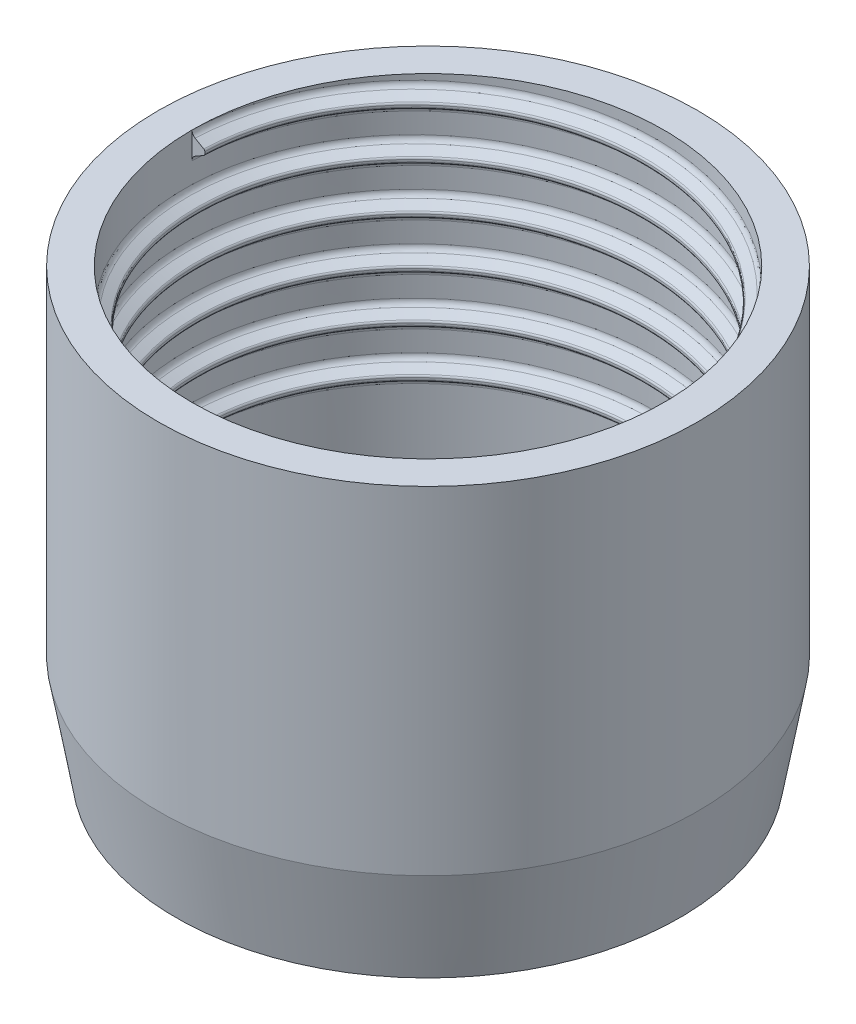
from build123d import *
from build123d.topology import SkipClean

# Parameters (mm, degrees)
SKETCH1_R           = 16
BOSS_EXTRUDE1_DEPTH = 20
SKETCH10_R          = 14
CUT_EXTRUDE2_DEPTH  = 20
THREAD1_PITCH       = 2.8
SKETCH20_R          = 16
BOSS_EXTRUDE3_DEPTH = 6
BOSS_EXTRUDE3_TAPER = 10
SKETCH19_R          = 6.6
CUT_EXTRUDE3_DEPTH  = 3
SKETCH127_R         = 5
CUT_EXTRUDE4_DEPTH  = 3


with BuildPart() as part:
    # Sketch1 → Boss-Extrude1 (new body)
    with BuildSketch(Plane(origin=(0, 0, 0), x_dir=(1, 0, 0), z_dir=(0, 1, 0))):
        with Locations(Location((0, 0, 0), (0, 0, 270))):
            Circle(SKETCH1_R)
    extrude(amount=BOSS_EXTRUDE1_DEPTH)

    # Sketch10 → Cut-Extrude2 (cut)
    with BuildSketch(Plane(origin=(0, 20, 0), x_dir=(1, 0, 0), z_dir=(0, 1, 0))):
        with Locations(Location((0, 0, 0), (0, 0, 270))):
            Circle(SKETCH10_R)
    extrude(amount=-CUT_EXTRUDE2_DEPTH, mode=Mode.SUBTRACT)

    # Thread1: the profile of Thread Profile2 profile screwed along a right-hand helix of 5.714286 turns, 10 arcs to a turn; built about Z, then put on its axis
    with SkipClean():  # the faces are left unmerged after this step: merging them gives an invalid solid
        thread1_z = Axis((0, 0, 0), (0, 0, 1))
        thread1_corners = [(14.0006, 0, 0), (14.0006, 0, 1.582940905), (14, 0, 1.582940905), (13.8095, 0, 1.252985226), (13.3015, 0, 0.95969129), (13.238, 0, 0.849706063), (13.238, 0, 0.733234842), (13.3015, 0, 0.623249616), (13.8095, 0, 0.329955679), (14, 0, 0)]
        with BuildLine(mode=Mode.PRIVATE) as thread1_profile:
            Line(thread1_corners[0], thread1_corners[1])
            Line(thread1_corners[3], thread1_corners[4])
            Line(thread1_corners[5], thread1_corners[6])
            Line(thread1_corners[7], thread1_corners[8])
            Line(thread1_corners[9], thread1_corners[0])
            Line(thread1_corners[2], thread1_corners[1])
            ThreePointArc((14, 0, 1.582940905), (13.948955679, 0, 1.392440905), (13.8095, 0, 1.252985226))
            ThreePointArc((13.3015, 0, 0.95969129), (13.255014774, 0, 0.913206063), (13.238, 0, 0.849706063))
            ThreePointArc((13.238, 0, 0.733234842), (13.255014774, 0, 0.669734842), (13.3015, 0, 0.623249616))
            ThreePointArc((13.8095, 0, 0.329955679), (13.948955679, 0, 0.1905), (14, 0, 0))
        thread1_cap = Face(thread1_profile.wire())
        thread1_arcs = [((14, 0, 1.582940905), (14, 0, 1.362970453), (13.8095, 0, 1.252985226), (1, 0.8660254037844384, 1)), ((13.3015, 0, 0.95969129), (13.238, 0, 0.923029547), (13.238, 0, 0.849706063), (1, 0.8660254037844385, 1)), ((13.238, 0, 0.733234842), (13.238, 0, 0.659911358), (13.3015, 0, 0.623249616), (1, 0.8660254037844376, 1)), ((13.8095, 0, 0.329955679), (14, 0, 0.219970453), (14, 0, 0), (1, 0.8660254037844375, 1))]  # start, shoulder, end, weights
        thread1_turn_angles = [0, 18, 36, 54, 72, 90, 108, 126, 144, 162, 180, 198, 216, 234, 252, 270, 288, 306, 324, 342, 360]
        thread1_turn_weights = [1, 0.9510565162951535, 1, 0.9510565162951535, 1, 0.9510565162951535, 1, 0.9510565162951535, 1, 0.9510565162951535, 1, 0.9510565162951535, 1, 0.9510565162951535, 1, 0.9510565162951535, 1, 0.9510565162951535, 1, 0.9510565162951535, 1]
        thread1_turn_rails = [Edge.make_bspline([Vector(p[0], p[1], 0).rotate(thread1_z, thread1_turn_angles[k]) / thread1_turn_weights[k] + Vector(0, 0, p[2] + THREAD1_PITCH * thread1_turn_angles[k] / 360) for k in range(21)], [0, 0, 0, 1, 1, 2, 2, 3, 3, 4, 4, 5, 5, 6, 6, 7, 7, 8, 8, 9, 9, 10, 10, 10], 2, thread1_turn_weights) for p in thread1_corners]
        thread1_turn_sides = [*[Face.make_surface_from_curves(thread1_turn_rails[p[0]], thread1_turn_rails[p[1]]) for p in [(0, 1), (3, 4), (5, 6), (7, 8), (9, 0), (2, 1)]], *[Face.make_bezier_surface([[Vector(p[j][0], p[j][1], 0).rotate(thread1_z, thread1_turn_angles[2 * i + k]) / thread1_turn_weights[2 * i + k] + Vector(0, 0, p[j][2] + THREAD1_PITCH * thread1_turn_angles[2 * i + k] / 360) for k in range(3)] for j in range(3)], [[p[3][j] * thread1_turn_weights[2 * i + k] for k in range(3)] for j in range(3)]) for p in thread1_arcs for i in range(10)]]
        thread1_last_angles = [1800, 1818, 1836, 1854, 1872, 1890, 1908, 1926, 1944, 1962, 1980, 1998, 2016, 2034, 2052, 2054.571428571, 2057.142857143]
        thread1_last_weights = [1, 0.9510565162951535, 1, 0.9510565162951535, 1, 0.9510565162951535, 1, 0.9510565162951535, 1, 0.9510565162951535, 1, 0.9510565162951535, 1, 0.9510565162951535, 1, 0.9989930665413146, 1]
        thread1_last_rails = [Edge.make_bspline([Vector(p[0], p[1], 0).rotate(thread1_z, thread1_last_angles[k]) / thread1_last_weights[k] + Vector(0, 0, p[2] + THREAD1_PITCH * thread1_last_angles[k] / 360) for k in range(17)], [0, 0, 0, 1, 1, 2, 2, 3, 3, 4, 4, 5, 5, 6, 6, 7, 7, 8, 8, 8], 2, thread1_last_weights) for p in thread1_corners]
        thread1_last_sides = [*[Face.make_surface_from_curves(thread1_last_rails[p[0]], thread1_last_rails[p[1]]) for p in [(0, 1), (3, 4), (5, 6), (7, 8), (9, 0), (2, 1)]], *[Face.make_bezier_surface([[Vector(p[j][0], p[j][1], 0).rotate(thread1_z, thread1_last_angles[2 * i + k]) / thread1_last_weights[2 * i + k] + Vector(0, 0, p[j][2] + THREAD1_PITCH * thread1_last_angles[2 * i + k] / 360) for k in range(3)] for j in range(3)], [[p[3][j] * thread1_last_weights[2 * i + k] for k in range(3)] for j in range(3)]) for p in thread1_arcs for i in range(8)]]
        thread1 = Plane(origin=(0, 20, 0), x_dir=(-1, 0, 0), z_dir=(0, -1, 0)) * Solid(Shell([*[p.moved(Location((0, 0, THREAD1_PITCH * i))) for i in range(5) for p in thread1_turn_sides], *thread1_last_sides, thread1_cap, thread1_cap.rotate(thread1_z, 2057.142857143).moved(Location((0, 0, THREAD1_PITCH * 2057.142857143 / 360)))]))
        add(thread1)

    # Sketch20 → Boss-Extrude3 (add)
    with SkipClean():  # the faces are left unmerged after this step: merging them gives an invalid solid
        with BuildSketch(Plane.XZ):
            with Locations(Location((0, 0, 0), (0, 0, 270))):
                Circle(SKETCH20_R)
        extrude(amount=BOSS_EXTRUDE3_DEPTH, taper=BOSS_EXTRUDE3_TAPER)

    # Sketch19 → Cut-Extrude3 (cut)
    with SkipClean():  # the faces are left unmerged after this step: merging them gives an invalid solid
        with BuildSketch(Plane(origin=(0, 0, 0), x_dir=(-1, 0, 0), z_dir=(0, -1, 0))):
            with Locations(Location((0, 0, 0), (0, 0, 90))):
                Circle(SKETCH19_R)
        extrude(amount=CUT_EXTRUDE3_DEPTH, mode=Mode.SUBTRACT)

    # Sketch127 → Cut-Extrude4 (cut)
    with SkipClean():  # the faces are left unmerged after this step: merging them gives an invalid solid
        with BuildSketch(Plane(origin=(0, -3, 0), x_dir=(1, 0, 0), z_dir=(0, 1, 0))):
            with Locations(Location((0, 0, 0), (0, 0, 270))):
                Circle(SKETCH127_R)
        extrude(amount=-CUT_EXTRUDE4_DEPTH, mode=Mode.SUBTRACT)


solid = part.part
